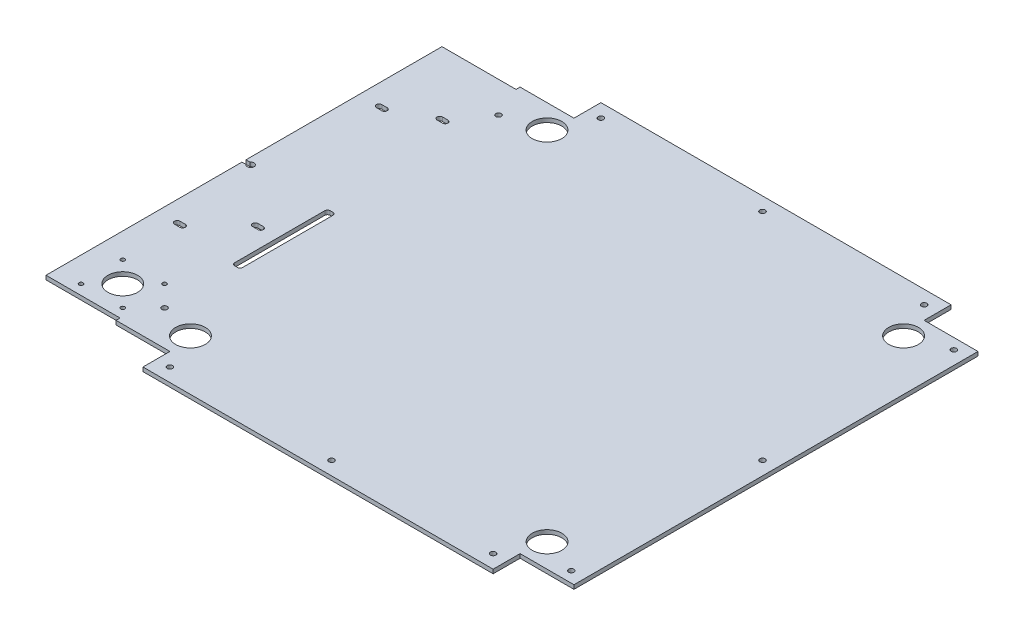
from build123d import *

# Parameters (mm, degrees)
SKETCH1_8_R         = 11
SKETCH1_8_R_2       = 2
SKETCH1_8_R_3       = 1.5
BOSS_EXTRUDE5_DEPTH = 3


with BuildPart() as part:
    # Sketch1<8> → Boss-Extrude5 (new body)
    with BuildSketch(Plane(origin=(0, 0, 0), x_dir=(1, 0, 0), z_dir=(0, 1, 0))):
        with BuildLine():
            Line((130, -150), (170, -150))
            Line((170, -150), (170, 150))
            Line((170, 150), (130, 150))
            Line((130, 150), (130, 170))
            Line((130, 170), (-130, 170))
            Line((-130, 170), (-130, 150))
            Line((-130, 150), (-170, 150))
            Line((-170, 150), (-170, 147))
            Line((-170, 147), (-225, 147))
            Line((-225, 147), (-225, 1.5))
            Line((-225, 1.5), (-222, 1.5))
            ThreePointArc((-222, 1.5), (-217.5, 0), (-222, -1.5))
            Line((-222, -1.5), (-225, -1.5))
            Line((-225, -1.5), (-225, -147))
            Line((-225, -147), (-170, -147))
            Line((-170, -147), (-170, -150))
            Line((-170, -150), (-130, -150))
            Line((-130, -150), (-130, -170))
            Line((-130, -170), (130, -170))
            Line((130, -170), (130, -150))
        make_face()
        with Locations((132.375, -132.375)):
            Circle(SKETCH1_8_R, mode=Mode.SUBTRACT)
        with Locations((132.375, 132.375)):
            Circle(SKETCH1_8_R, mode=Mode.SUBTRACT)
        with Locations((160, -142)):
            Circle(SKETCH1_8_R_2, mode=Mode.SUBTRACT)
        with Locations((160, 0)):
            Circle(SKETCH1_8_R_2, mode=Mode.SUBTRACT)
        with Locations((160, 142)):
            Circle(SKETCH1_8_R_2, mode=Mode.SUBTRACT)
        with Locations((-132.375, 132.375)):
            Circle(SKETCH1_8_R, mode=Mode.SUBTRACT)
        with BuildLine():
            ThreePointArc((-163, -2), (-162.414213562, -0.585786438), (-161, 0))
            Line((-161, 0), (-159, 0))
            ThreePointArc((-159, 0), (-157.585786438, -0.585786438), (-157, -2))
            Line((-157, -2), (-157, -68.911348687))
            ThreePointArc((-157, -68.911348687), (-157.585786438, -70.325562249), (-159, -70.911348687))
            Line((-159, -70.911348687), (-161, -70.911348687))
            ThreePointArc((-161, -70.911348687), (-162.414213562, -70.325562249), (-163, -68.911348687))
            Line((-163, -68.911348687), (-163, -2))
        make_face(mode=Mode.SUBTRACT)
        with Locations((-160, 124)):
            Circle(SKETCH1_8_R_2, mode=Mode.SUBTRACT)
        with Locations((-132.375, -132.375)):
            Circle(SKETCH1_8_R, mode=Mode.SUBTRACT)
        with Locations((-160, -124)):
            Circle(SKETCH1_8_R_2, mode=Mode.SUBTRACT)
        with Locations((0, -160)):
            Circle(SKETCH1_8_R_2, mode=Mode.SUBTRACT)
        with Locations((120, -160)):
            Circle(SKETCH1_8_R_2, mode=Mode.SUBTRACT)
        with Locations((-120, -160)):
            Circle(SKETCH1_8_R_2, mode=Mode.SUBTRACT)
        with Locations((-175.5, -108.5)):
            Circle(SKETCH1_8_R_3, mode=Mode.SUBTRACT)
        with Locations((-206.5, -139.5)):
            Circle(SKETCH1_8_R_3, mode=Mode.SUBTRACT)
        with Locations((-175.5, -139.5)):
            Circle(SKETCH1_8_R_3, mode=Mode.SUBTRACT)
        with Locations((-191, -124)):
            Circle(SKETCH1_8_R, mode=Mode.SUBTRACT)
        with Locations((-206.5, -108.5)):
            Circle(SKETCH1_8_R_3, mode=Mode.SUBTRACT)
        with BuildLine():
            ThreePointArc((-210.1, -66.5), (-212.1, -64.5), (-210.1, -62.5))
            Line((-210.1, -62.5), (-206.1, -62.5))
            ThreePointArc((-206.1, -62.5), (-204.1, -64.5), (-206.1, -66.5))
            Line((-206.1, -66.5), (-210.1, -66.5))
        make_face(mode=Mode.SUBTRACT)
        with BuildLine():
            ThreePointArc((-179.6, -39), (-181.6, -37), (-179.6, -35))
            Line((-179.6, -35), (-175.6, -35))
            ThreePointArc((-175.6, -35), (-173.6, -37), (-175.6, -39))
            Line((-175.6, -39), (-179.6, -39))
        make_face(mode=Mode.SUBTRACT)
        with BuildLine():
            ThreePointArc((-210.1, 83.4), (-212.1, 85.4), (-210.1, 87.4))
            Line((-210.1, 87.4), (-206.1, 87.4))
            ThreePointArc((-206.1, 87.4), (-204.1, 85.4), (-206.1, 83.4))
            Line((-206.1, 83.4), (-210.1, 83.4))
        make_face(mode=Mode.SUBTRACT)
        with BuildLine():
            ThreePointArc((-179.6, 98), (-181.6, 100), (-179.6, 102))
            Line((-179.6, 102), (-175.6, 102))
            ThreePointArc((-175.6, 102), (-173.6, 100), (-175.6, 98))
            Line((-175.6, 98), (-179.6, 98))
        make_face(mode=Mode.SUBTRACT)
        with Locations((0, 160)):
            Circle(SKETCH1_8_R_2, mode=Mode.SUBTRACT)
        with Locations((120, 160)):
            Circle(SKETCH1_8_R_2, mode=Mode.SUBTRACT)
        with Locations((-120, 160)):
            Circle(SKETCH1_8_R_2, mode=Mode.SUBTRACT)
    extrude(amount=BOSS_EXTRUDE5_DEPTH)


solid = part.part
